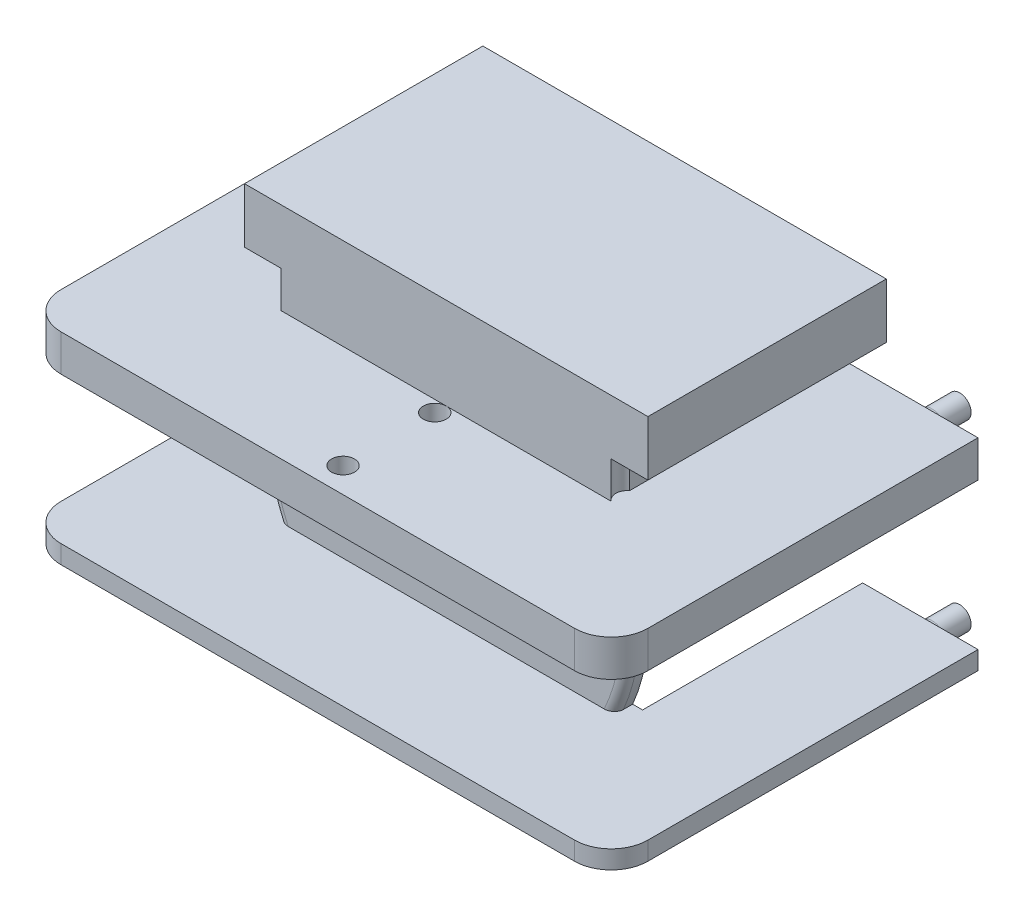
from build123d import *

# Parameters (mm, degrees)
BOSS_EXTRUDE1_DEPTH     = 1
SKETCH2_R               = 1.475
BOSS_EXTRUDE2_DEPTH     = 14
SKETCH3_R               = 1.8
BOSS_EXTRUDE3_DEPTH     = 0.75
SKETCH4_W               = 2
SKETCH4_H               = 17
BOSS_EXTRUDE4_DEPTH     = 12
SKETCH5_W               = 18
SKETCH5_H               = 2
BOSS_EXTRUDE5_DEPTH     = 12
SKETCH6_W               = 13
SKETCH6_H               = 2
BOSS_EXTRUDE6_DEPTH     = 5
BOSS_EXTRUDE7_DEPTH     = 12
CUT_EXTRUDE1_DEPTH      = 24.366642891
SKETCH9_W               = 2.937742252
SKETCH9_H               = 8
CUT_EXTRUDE2_DEPTH      = 12
CUT_EXTRUDE11_START     = -12
SKETCH21_R              = 10.5
SKETCH21_R_2            = 1.8
CUT_EXTRUDE11_DEPTH     = 12
SKETCH10_W              = 32
SKETCH10_H              = 2
BOSS_EXTRUDE8_DEPTH     = 7
FILLET1_R               = 0.5
SKETCH11_R              = 0.625
BOSS_EXTRUDE9_DEPTH     = 2
SKETCH14_W              = 2
SKETCH14_H              = 2
CUT_EXTRUDE5_DEPTH      = 28.874719859
SKETCH12_R              = 0.725
CUT_EXTRUDE3_DEPTH      = 2.5
CUT_EXTRUDE6_DEPTH      = 2
FILLET2_R               = 0.5
FILLET3_R               = 0.5
FILLET4_R               = 2
CUT_EXTRUDE7_DEPTH      = 28.221315288
CUT_EXTRUDE7_DEPTH_BACK = 1
SKETCH19_R              = 0.625
CUT_EXTRUDE9_DEPTH      = 2
FILLET5_R               = 0.4
CUT_EXTRUDE12_REACH     = 29.875


with BuildPart() as part:
    # Sketch1 → Boss-Extrude1 (new body)
    with BuildSketch(Plane.XY):
        Polygon((-11, 6), (-11, 11), (11, 11), (11, 6), (11, -6), (-11, -6), align=None)
    extrude(amount=BOSS_EXTRUDE1_DEPTH)

    # Sketch2 → Boss-Extrude2 (add)
    with BuildSketch(Plane(origin=(0, 0, 0), x_dir=(-1, 0, 0), z_dir=(0, 0, -1))):
        with Locations(Location((0, 0, 0), (0, 0, 180))):
            Circle(SKETCH2_R)
    extrude(amount=BOSS_EXTRUDE2_DEPTH)

    # Sketch3 → Boss-Extrude3 (add)
    with BuildSketch(Plane(origin=(0, 0, 0), x_dir=(-1, 0, 0), z_dir=(0, 0, -1))):
        with Locations(Location((0, 0, 0), (0, 0, 180))):
            Circle(SKETCH3_R)
    extrude(amount=BOSS_EXTRUDE3_DEPTH)

    # Sketch4 → Boss-Extrude4 (add)
    with BuildSketch(Plane(origin=(0, 0, 0), x_dir=(-1, 0, 0), z_dir=(0, 0, -1))):
        with Locations((10, 2.5)):
            Rectangle(SKETCH4_W, SKETCH4_H)
        with Locations((-10, 2.5)):
            Rectangle(SKETCH4_W, SKETCH4_H)
    extrude(amount=BOSS_EXTRUDE4_DEPTH)

    # Sketch5 → Boss-Extrude5 (add)
    with BuildSketch(Plane(origin=(0, 0, 0), x_dir=(-1, 0, 0), z_dir=(0, 0, -1))):
        with Locations((0, 10)):
            Rectangle(SKETCH5_W, SKETCH5_H)
    extrude(amount=BOSS_EXTRUDE5_DEPTH)

    # Sketch6 → Boss-Extrude6 (add)
    with BuildSketch(Plane(origin=(11, 0, 0), x_dir=(0, 0, -1), z_dir=(1, 0, 0))):
        with Locations((5.5, -5)):
            Rectangle(SKETCH6_W, SKETCH6_H)
        with Locations((5.5, 5)):
            Rectangle(SKETCH6_W, SKETCH6_H)
    boss_extrude6 = extrude(amount=BOSS_EXTRUDE6_DEPTH)

    # Mirror1: Boss-Extrude6 across plane
    add(boss_extrude6.mirror(Plane(origin=(0, 0, 0), x_dir=(0, 0, 1), z_dir=(1, 0, 0))))

    # Sketch7 → Boss-Extrude7 (add)
    with BuildSketch(Plane(origin=(0, 0, -12), x_dir=(-1, 0, 0), z_dir=(0, 0, -1))):
        with BuildLine():
            ThreePointArc((-6.708203932, -6), (-8.407551231, -3.211398808), (-9, 0))
            Line((-9, 0), (-9, -6))
            Line((-9, -6), (-6.708203932, -6))
        make_face()
        with BuildLine():
            Line((-9, 9), (-9, 0))
            ThreePointArc((-9, 0), (-6.363961031, 6.363961031), (0, 9))
            Line((0, 9), (-9, 9))
        make_face()
    boss_extrude7 = extrude(amount=-BOSS_EXTRUDE7_DEPTH)

    # Sketch8 → Cut-Extrude1 (cut, through all)
    with BuildSketch(Plane(origin=(0, 0, -12), x_dir=(-1, 0, 0), z_dir=(0, 0, -1))):
        with BuildLine():
            Line((-11, 4), (-9.16515139, 4))
            ThreePointArc((-9.16515139, 4), (-10, 0), (-9.16515139, -4))
            Line((-9.16515139, -4), (-11, -4))
            Line((-11, -4), (-11, 4))
        make_face()
    cut_extrude1 = extrude(amount=-CUT_EXTRUDE1_DEPTH, mode=Mode.SUBTRACT)

    # Sketch9 → Cut-Extrude2 (cut)
    with BuildSketch(Plane(origin=(0, 0, -12), x_dir=(-1, 0, 0), z_dir=(0, 0, -1))):
        with Locations((-9.531128874, 0)):
            Rectangle(SKETCH9_W, SKETCH9_H)
    cut_extrude2 = extrude(amount=-CUT_EXTRUDE2_DEPTH, mode=Mode.SUBTRACT)

    # Mirror2: Boss-Extrude7, Cut-Extrude1, Cut-Extrude2 across plane
    add(boss_extrude7.mirror(Plane(origin=(0, 0, 0), x_dir=(0, 0, 1), z_dir=(1, 0, 0))))
    add(cut_extrude1.mirror(Plane(origin=(0, 0, 0), x_dir=(0, 0, 1), z_dir=(1, 0, 0))), mode=Mode.SUBTRACT)
    add(cut_extrude2.mirror(Plane(origin=(0, 0, 0), x_dir=(0, 0, 1), z_dir=(1, 0, 0))), mode=Mode.SUBTRACT)

    # Sketch21 → Cut-Extrude11 (cut)
    with BuildSketch(Plane(origin=(0, 0, -12), x_dir=(-1, 0, 0), z_dir=(0, 0, -1)).offset(CUT_EXTRUDE11_START)):
        Circle(SKETCH21_R)
        with Locations(Location((0, 0, 0), (0, 0, 180))):
            Circle(SKETCH21_R_2, mode=Mode.SUBTRACT)
    extrude(amount=CUT_EXTRUDE11_DEPTH, mode=Mode.SUBTRACT)

    # Sketch10 → Boss-Extrude8 (add)
    with BuildSketch(Plane.XY.offset(1)):
        with Locations((0, -5)):
            Rectangle(SKETCH10_W, SKETCH10_H)
        with Locations((0, 5)):
            Rectangle(SKETCH10_W, SKETCH10_H)
    extrude(amount=BOSS_EXTRUDE8_DEPTH)

    # Fillet1
    fillet1_edges = [part.edges().sort_by_distance(p)[0] for p in [
        (10, 0, 1),
        (-10, 0, 1),
    ]]
    fillet(fillet1_edges, radius=FILLET1_R)

    # Sketch11 → Boss-Extrude9 (add)
    with BuildSketch(Plane(origin=(0, 0, -12), x_dir=(-1, 0, 0), z_dir=(0, 0, -1))):
        with Locations(Location((-13, -5, 0), (0, 0, 180))):
            Circle(SKETCH11_R)
    boss_extrude9 = extrude(amount=BOSS_EXTRUDE9_DEPTH)

    # Sketch14 → Cut-Extrude5 (cut, through all)
    with BuildSketch(Plane(origin=(0, 0, -12), x_dir=(-1, 0, 0), z_dir=(0, 0, -1))):
        with Locations((10, 7)):
            Rectangle(SKETCH14_W, SKETCH14_H)
        with Locations((-10, 7)):
            Rectangle(SKETCH14_W, SKETCH14_H)
    extrude(amount=-CUT_EXTRUDE5_DEPTH, mode=Mode.SUBTRACT)

    # Sketch12 → Cut-Extrude3 (cut)
    with BuildSketch(Plane(origin=(0, 0, -12), x_dir=(-1, 0, 0), z_dir=(0, 0, -1))):
        with Locations((13, -5)):
            Circle(SKETCH12_R)
    cut_extrude3 = extrude(amount=-CUT_EXTRUDE3_DEPTH, mode=Mode.SUBTRACT)

    # Sketch16 → Cut-Extrude6 (cut)
    with BuildSketch(Plane(origin=(0, 6, 0), x_dir=(1, 0, 0), z_dir=(0, 1, 0))):
        with BuildLine():
            Line((-9, 0), (-9, -1))
            ThreePointArc((-9, -1), (-8.75, -0.5), (-9, 0))
        make_face()
    cut_extrude6 = extrude(amount=CUT_EXTRUDE6_DEPTH, mode=Mode.SUBTRACT)

    # Mirror3: Boss-Extrude9, Cut-Extrude3 across plane
    add(boss_extrude9.mirror(Plane.ZX))
    add(cut_extrude3.mirror(Plane.ZX), mode=Mode.SUBTRACT)

    # Mirror4: Cut-Extrude6 across plane
    add(cut_extrude6.mirror(Plane(origin=(0, 0, 0), x_dir=(0, 0, 1), z_dir=(1, 0, 0))), mode=Mode.SUBTRACT)

    # Fillet2
    fillet2_edges = [part.edges().sort_by_distance(p)[0] for p in [
        (12.375, -5, -12),
        (12.375, 5, -12),
    ]]
    fillet(fillet2_edges, radius=FILLET2_R)

    # Fillet3
    # the kernel refuses this fillet: 0.5 mm, written as the material it takes off along each edge
    with BuildSketch(Plane(origin=(-13, -5, -12), x_dir=(-1, 0, 0), z_dir=(0, -1, 0))) as fillet3_piece_1:
        with BuildLine():
            CenterArc((0.725 + FILLET3_R, -FILLET3_R), FILLET3_R, 90, 90)
            Line((0.725, -FILLET3_R), (0.725, 0))
            Line((0.725, 0), (0.725 + FILLET3_R, 0))
        make_face()
    revolve(axis=Axis((-13, -5, -12), (0, 0, -1)), mode=Mode.SUBTRACT)
    with BuildSketch(Plane(origin=(-13, 5, -12), x_dir=(-1, 0, 0), z_dir=(0, 1, 0))) as fillet3_piece_2:
        with BuildLine():
            CenterArc((0.725 + FILLET3_R, FILLET3_R), FILLET3_R, 180, 90)
            Line((0.725, FILLET3_R), (0.725, 0))
            Line((0.725, 0), (0.725 + FILLET3_R, 0))
        make_face()
    revolve(axis=Axis((-13, 5, -12), (0, 0, 1)), mode=Mode.SUBTRACT)

    # Fillet4
    fillet4_edges = [part.edges().sort_by_distance(p)[0] for p in [
        (16, -5, 8),
        (-16, -5, 8),
        (-16, 5, 8),
        (16, 5, 8),
    ]]
    fillet(fillet4_edges, radius=FILLET4_R)

    # Sketch17 → Cut-Extrude7 (cut, two sides: drawn at the far end of the back side and taken through both)
    with BuildSketch(Plane.XZ.offset(6).offset(-CUT_EXTRUDE7_DEPTH_BACK)):
        with BuildLine():
            Line((-16, 6), (-16, -12))
            Line((-16, -12), (-14.5, -12))
            Line((-14.5, -12), (-14.5, 6))
            ThreePointArc((-14.5, 6), (-14.353553391, 6.353553391), (-14, 6.5))
            Line((-14, 6.5), (14, 6.5))
            ThreePointArc((14, 6.5), (14.353553391, 6.353553391), (14.5, 6))
            Line((14.5, 6), (14.5, -12))
            Line((14.5, -12), (16, -12))
            Line((16, -12), (16, 6))
            ThreePointArc((16, 6), (15.414213562, 7.414213562), (14, 8))
            Line((14, 8), (-14, 8))
            ThreePointArc((-14, 8), (-15.414213562, 7.414213562), (-16, 6))
        make_face()
    extrude(amount=CUT_EXTRUDE7_DEPTH + CUT_EXTRUDE7_DEPTH_BACK, mode=Mode.SUBTRACT)

    # Sketch19 → Cut-Extrude9 (cut)
    with BuildSketch(Plane(origin=(0, 6, 0), x_dir=(1, 0, 0), z_dir=(0, 1, 0))):
        with Locations(Location((0, -1.625, 0), (0, 0, 90))):
            Circle(SKETCH19_R)
        with Locations(Location((0, -6.625, 0), (0, 0, 270))):
            Circle(SKETCH19_R)
    extrude(amount=-CUT_EXTRUDE9_DEPTH, mode=Mode.SUBTRACT)

    # Fillet5
    fillet5_edges = [part.edges().sort_by_distance(p)[0] for p in [
        (-1.475, 0, -14),
    ]]
    fillet(fillet5_edges, radius=FILLET5_R)

    # Cut-Extrude12: up to this face of the body (flat: up to its plane)
    cut_extrude12_end = Plane(part.part.faces().sort_by_distance((-13, -5, -9.5))[0])
    # Sketch22 → Cut-Extrude12 (cut, up to the picked face)
    with BuildSketch(Plane(origin=(0, 0, -12), x_dir=(-1, 0, 0), z_dir=(0, 0, -1)), mode=Mode.PRIVATE) as cut_extrude12_sk1:
        with BuildLine():
            Line((12.6, -6), (12.6, -4))
            ThreePointArc((12.6, -4), (13, -3.6), (13.4, -4))
            Line((13.4, -4), (13.4, -6))
            ThreePointArc((13.4, -6), (13, -6.4), (12.6, -6))
        make_face()
    cut_extrude12_tool1 = split(extrude(cut_extrude12_sk1.sketch, amount=-CUT_EXTRUDE12_REACH, mode=Mode.PRIVATE), bisect_by=cut_extrude12_end, keep=Keep.BOTH, mode=Mode.PRIVATE)
    cut_extrude12 = cut_extrude12_tool1.solids().sort_by(Axis((-13, -5, -12), (0, 0, 1)))[0]
    add(cut_extrude12, mode=Mode.SUBTRACT)

    # Mirror5: Cut-Extrude12 across plane
    add(cut_extrude12.mirror(Plane.ZX), mode=Mode.SUBTRACT)


solid = part.part
